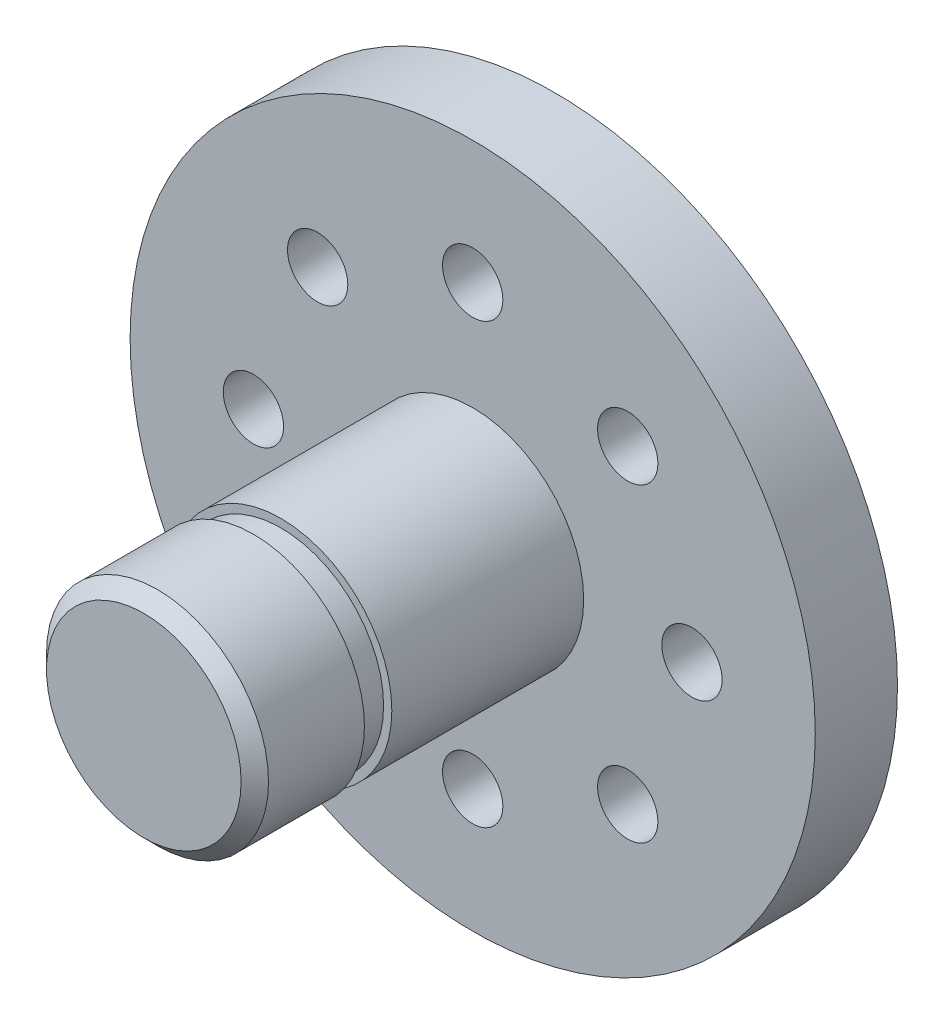
from build123d import *

# Parameters (mm, degrees)
SKETCH1_R           = 12.5
SKETCH1_R_2         = 1.1
BOSS_EXTRUDE1_DEPTH = 3
SKETCH2_R           = 4.05
BOSS_EXTRUDE2_DEPTH = 12
SKETCH3_W           = 1
SKETCH3_H           = 0.6
FILLET1_SIZE        = 0.5


with BuildPart() as part:
    # Sketch1 → Boss-Extrude1 (new body)
    with BuildSketch(Plane.XY):
        Circle(SKETCH1_R)
        with Locations((0, 8)):
            Circle(SKETCH1_R_2, mode=Mode.SUBTRACT)
        with Locations((5.656854249, 5.656854249)):
            Circle(SKETCH1_R_2, mode=Mode.SUBTRACT)
        with Locations((8, 0)):
            Circle(SKETCH1_R_2, mode=Mode.SUBTRACT)
        with Locations((5.656854249, -5.656854249)):
            Circle(SKETCH1_R_2, mode=Mode.SUBTRACT)
        with Locations((0, -8)):
            Circle(SKETCH1_R_2, mode=Mode.SUBTRACT)
        with Locations((-5.656854249, -5.656854249)):
            Circle(SKETCH1_R_2, mode=Mode.SUBTRACT)
        with Locations((-8, 0)):
            Circle(SKETCH1_R_2, mode=Mode.SUBTRACT)
        with Locations((-5.656854249, 5.656854249)):
            Circle(SKETCH1_R_2, mode=Mode.SUBTRACT)
    extrude(amount=BOSS_EXTRUDE1_DEPTH)

    # Sketch2 → Boss-Extrude2 (add)
    with BuildSketch(Plane.XY.offset(3)):
        Circle(SKETCH2_R)
    extrude(amount=BOSS_EXTRUDE2_DEPTH)

    # Sketch3 → Cut-Revolve1 (revolve, cut)
    with BuildSketch(Plane(origin=(0, 0, 0), x_dir=(0, 0, -1), z_dir=(1, 0, 0))):
        with Locations((-10.5, 4.05)):
            Rectangle(SKETCH3_W, SKETCH3_H)
    revolve(axis=Axis((0, 0, 15), (0, 0, -1)), mode=Mode.SUBTRACT)

    # Fillet1
    fillet1_edges = [part.edges().sort_by_distance(p)[0] for p in [
        (-4.05, 0, 15),
    ]]
    chamfer(fillet1_edges, length=FILLET1_SIZE)


solid = part.part
